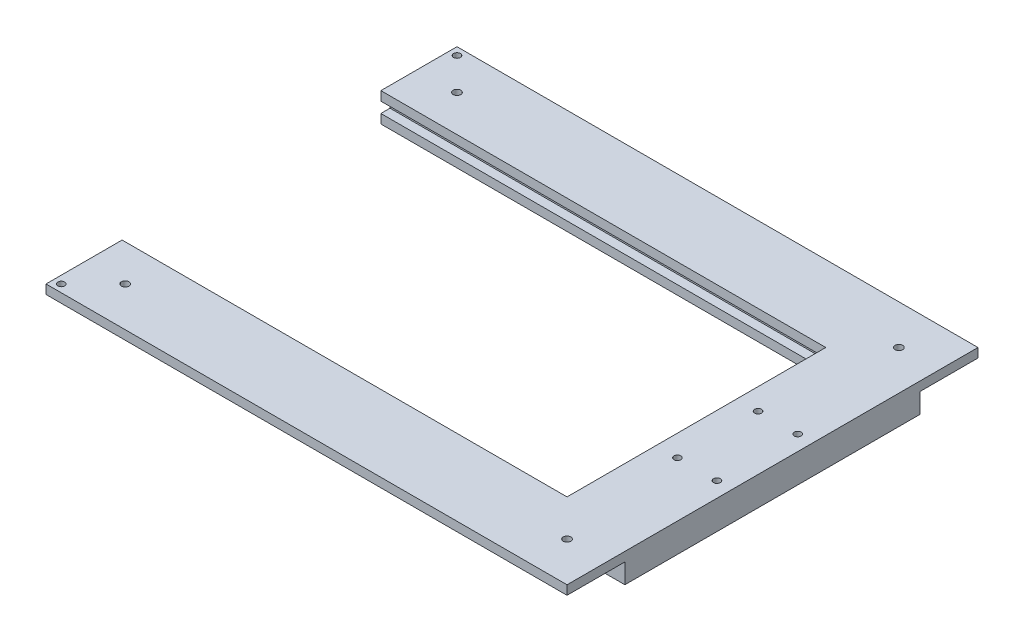
from build123d import *

# Parameters (mm, degrees)
EXTRUDE_2_DEPTH             = 6
EXTRUDE_3_DEPTH             = 7
SKETCH_4_R                  = 2.5
CUT_EXTRUDE_1_DEPTH         = 455.596156824
PATTERN_LINEAR_2_COUNT      = 2
PATTERN_LINEAR_2_PITCH      = 290.3
PATTERN_LINEAR_2_COUNT_DIR2 = 2
PATTERN_LINEAR_2_PITCH_DIR2 = 218
EXTRUDE_4_DEPTH             = 6
SKETCH_6_R                  = 2.25
CUT_EXTRUDE_2_DEPTH         = 455.807284242
SKETCH_7_R                  = 2.25
CUT_EXTRUDE_3_DEPTH         = 455.596156824


with BuildPart() as part:
    # Эскиз1 → Бобышка-Вытянуть2 (new body)
    with BuildSketch(Plane(origin=(0, 0, 0), x_dir=(1, 0, 0), z_dir=(0, 1, 0))):
        Polygon((50, -77.921508101), (50, -347.921508101), (-292.3, -347.921508101), (-292.3, -297.921508101), (0, -297.921508101), (0, -127.921508101), (-292.3, -127.921508101), (-292.3, -77.921508101), align=None)
    extrude(amount=EXTRUDE_2_DEPTH)

    # Эскиз2 → Бобышка-Вытянуть3 (add)
    with BuildSketch(Plane.XZ):
        Polygon((50, 309.921508101), (50, 115.921508101), (-292.3, 115.921508101), (-292.3, 121.921508101), (6, 121.921508101), (6, 303.921508101), (-292.3, 303.921508101), (-292.3, 309.921508101), align=None)
    extrude(amount=EXTRUDE_3_DEPTH)

    # Эскиз4 → Вырез-Вытянуть1 (cut, through all)
    with BuildSketch(Plane(origin=(0, 6, 0), x_dir=(1, 0, 0), z_dir=(0, 1, 0))):
        with Locations((-266.3, -103.921508101)):
            Circle(SKETCH_4_R)
    cut_extrude_1 = extrude(amount=-CUT_EXTRUDE_1_DEPTH, mode=Mode.SUBTRACT)

    # Линейный массив2: Cut-Extrude 1 2 × 2
    with Locations(*[(i * PATTERN_LINEAR_2_PITCH, 0, j * PATTERN_LINEAR_2_PITCH_DIR2) for i in range(PATTERN_LINEAR_2_COUNT) for j in range(PATTERN_LINEAR_2_COUNT_DIR2) if (i, j) != (0, 0)]):
        add(cut_extrude_1, mode=Mode.SUBTRACT)

    # Эскиз5 → Бобышка-Вытянуть4 (add)
    with BuildSketch(Plane.XZ.offset(7)):
        Polygon((50, 309.921508101), (-292.3, 309.921508101), (-292.3, 297.921508101), (0, 297.921508101), (0, 127.921508101), (-292.3, 127.921508101), (-292.3, 115.921508101), (50, 115.921508101), align=None)
    extrude(amount=EXTRUDE_4_DEPTH)

    # Эскиз6 → Вырез-Вытянуть2 (cut, through all)
    with BuildSketch(Plane.XZ.offset(13)):
        with Locations((14, 239.421508101)):
            Circle(SKETCH_6_R)
        with Locations((40, 239.421508101)):
            Circle(SKETCH_6_R)
        with Locations((40, 186.421508101)):
            Circle(SKETCH_6_R)
        with Locations((14, 186.421508101)):
            Circle(SKETCH_6_R)
    extrude(amount=-CUT_EXTRUDE_2_DEPTH, mode=Mode.SUBTRACT)

    # Эскиз7 → Вырез-Вытянуть3 (cut, through all)
    with BuildSketch(Plane.XZ):
        with Locations((-287.3, 342.921508101)):
            Circle(SKETCH_7_R)
        with Locations((-287.3, 82.921508101)):
            Circle(SKETCH_7_R)
    extrude(amount=-CUT_EXTRUDE_3_DEPTH, mode=Mode.SUBTRACT)


solid = part.part
